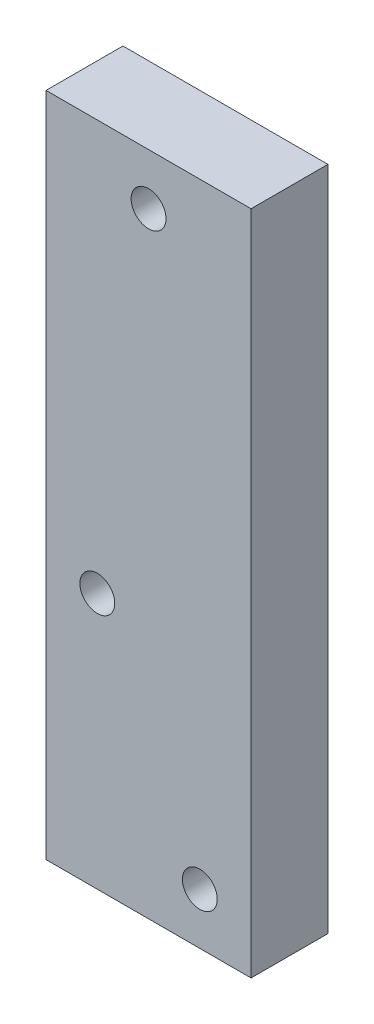
from build123d import *

# Parameters (mm, degrees)
SKETCH1_W           = 25.4
SKETCH1_H           = 82.55
SKETCH1_R           = 2.159
BOSS_EXTRUDE1_DEPTH = 9.525


with BuildPart() as part:
    # Sketch1 → Boss-Extrude1 (new body)
    with BuildSketch(Plane.XY):
        with Locations((0, -34.925)):
            Rectangle(SKETCH1_W, SKETCH1_H)
        Circle(SKETCH1_R, mode=Mode.SUBTRACT)
        with Locations((-6.35, -44.45)):
            Circle(SKETCH1_R, mode=Mode.SUBTRACT)
        with Locations((6.35, -69.85)):
            Circle(SKETCH1_R, mode=Mode.SUBTRACT)
    extrude(amount=BOSS_EXTRUDE1_DEPTH)


solid = part.part
